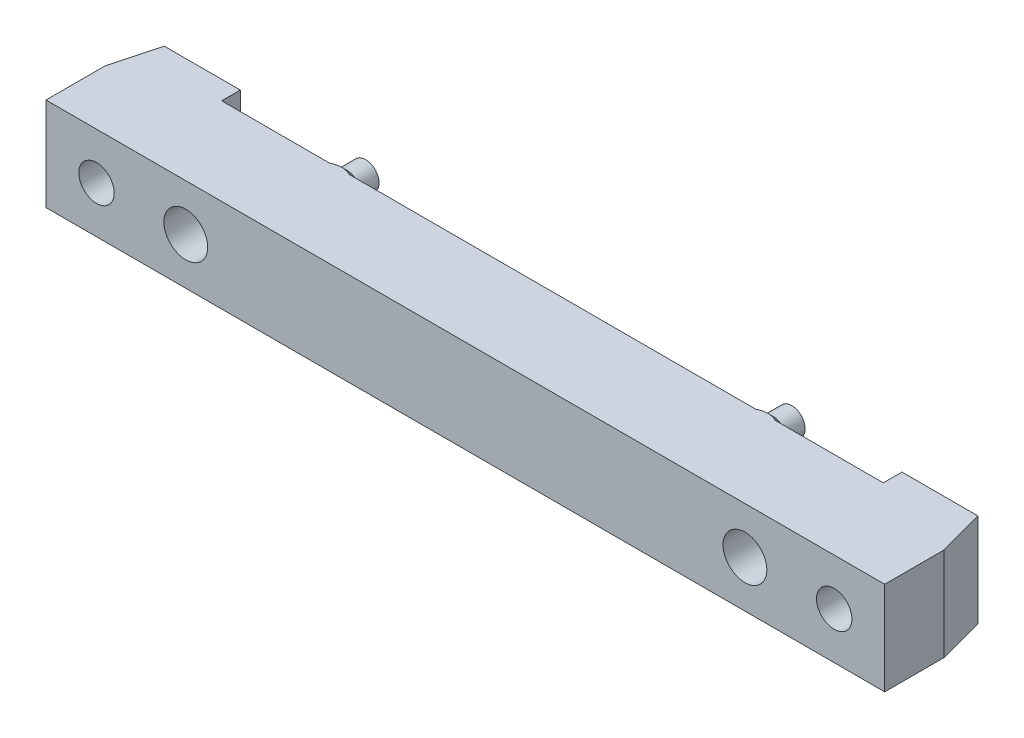
from build123d import *
from OCP.BRepFilletAPI import BRepFilletAPI_MakeChamfer

# Parameters (mm, degrees)
SKETCH2_W                       = 90
SKETCH2_H                       = 10
BOSS_EXTRUDE1_DEPTH             = 9.35
SKETCH4_W                       = 9.5
SKETCH4_H                       = 10
BOSS_EXTRUDE2_DEPTH             = 2
SKETCH5_R                       = 1.45
BOSS_EXTRUDE3_DEPTH             = 2.8
CHAMFER1_SIZE                   = 0.8
CHAMFER2_SIZE                   = 5
CHAMFER2_SIZE2                  = 1.339745962
F_13_0_185_DIAMETER_HOLE1_D     = 4.699
F_13_0_185_DIAMETER_HOLE1_DEPTH = 6.35
F_6_CLEARANCE_HOLE1_D           = 3.7973
F_6_CLEARANCE_HOLE1_ON_FACE_2_D = 3.7973
F_13_0_185_DIAMETER_HOLE2_D     = 4.699
F_13_0_185_DIAMETER_HOLE2_DEPTH = 6.35
F_6_CLEARANCE_HOLE2_D           = 3.7973


with BuildPart() as part:
    # Sketch2 → Boss-Extrude1 (new body)
    with BuildSketch(Plane.XY):
        with Locations((45, 5)):
            Rectangle(SKETCH2_W, SKETCH2_H)
    extrude(amount=BOSS_EXTRUDE1_DEPTH)

    # Sketch4 → Boss-Extrude2 (add)
    with BuildSketch(Plane(origin=(0, 0, 0), x_dir=(-1, 0, 0), z_dir=(0, 0, -1))):
        with Locations((-4.75, 5)):
            Rectangle(SKETCH4_W, SKETCH4_H)
        with Locations((-85.25, 5)):
            Rectangle(SKETCH4_W, SKETCH4_H)
    extrude(amount=BOSS_EXTRUDE2_DEPTH)

    # Sketch5 → Boss-Extrude3 (add)
    with BuildSketch(Plane(origin=(0, 0, 0), x_dir=(-1, 0, 0), z_dir=(0, 0, -1))):
        with Locations(Location((-67.863406388, 8.0148451, 0), (0, 0, 180))):
            Circle(SKETCH5_R)
        with Locations(Location((-22.143406388, 8.0148451, 0), (0, 0, 180))):
            Circle(SKETCH5_R)
    extrude(amount=BOSS_EXTRUDE3_DEPTH)

    # Chamfer1
    # the kernel refuses this chamfer: 0.8 mm, written as the material it adds along each edge
    with BuildSketch(Plane(origin=(67.863406388, 8.0148451, 0), x_dir=(1, 0, 0), z_dir=(0, 1, 0))) as chamfer1_piece_1_section:
        Polygon((1.45 + CHAMFER1_SIZE, 0), (1.45, CHAMFER1_SIZE), (1.45, 0), align=None)
    chamfer1_piece_1 = revolve(axis=Axis((67.863406388, 8.0148451, 0), (0, 0, -1)), mode=Mode.PRIVATE)
    chamfer1_piece_1 = split(chamfer1_piece_1, bisect_by=Plane(origin=(66.024382204, 10, -0.389024184), z_dir=(0, -1, 0)), keep=Keep.TOP, mode=Mode.PRIVATE)
    add(chamfer1_piece_1)
    with BuildSketch(Plane(origin=(22.143406388, 8.0148451, 0), x_dir=(1, 0, 0), z_dir=(0, 1, 0))) as chamfer1_piece_2_section:
        Polygon((1.45 + CHAMFER1_SIZE, 0), (1.45, CHAMFER1_SIZE), (1.45, 0), align=None)
    chamfer1_piece_2 = revolve(axis=Axis((22.143406388, 8.0148451, 0), (0, 0, -1)), mode=Mode.PRIVATE)
    chamfer1_piece_2 = split(chamfer1_piece_2, bisect_by=Plane(origin=(20.304382204, 10, -0.389024184), z_dir=(0, -1, 0)), keep=Keep.TOP, mode=Mode.PRIVATE)
    add(chamfer1_piece_2)

    # Chamfer2: one chamfer whose edges measure the first distance from different faces: ONE call of the kernel's chamfer builder (chamfer() names one face for all edges)
    chamfer2_edges_1 = [part.edges().sort_by_distance(p)[0] for p in [
        (0, 5, -2),
    ]]
    chamfer2_side_1 = [part.faces().sort_by_distance(p)[0] for p in [
        (0, 5, 3.675),
    ]]
    chamfer2_edges_2 = [part.edges().sort_by_distance(p)[0] for p in [
        (90, 5, -2),
    ]]
    chamfer2_side_2 = [part.faces().sort_by_distance(p)[0] for p in [
        (90, 5, 3.675),
    ]]
    chamfer2 = BRepFilletAPI_MakeChamfer(part.part.solid().wrapped)
    for e in chamfer2_edges_1:
        chamfer2.Add(CHAMFER2_SIZE, CHAMFER2_SIZE2, e.wrapped, chamfer2_side_1[0].wrapped)  # the first distance lies on this face
    for e in chamfer2_edges_2:
        chamfer2.Add(CHAMFER2_SIZE, CHAMFER2_SIZE2, e.wrapped, chamfer2_side_2[0].wrapped)  # the first distance lies on this face
    add(Compound.cast(chamfer2.Shape()), mode=Mode.REPLACE)

    # #13 (0.185) Diameter Hole1
    with Locations(Plane(origin=(84.580127019, 5, -2), x_dir=(-1, 0, 0), z_dir=(0, 0, -1))):
        with Locations((0, 0), (79.160254038, 0)):
            Hole(F_13_0_185_DIAMETER_HOLE1_D / 2, depth=F_13_0_185_DIAMETER_HOLE1_DEPTH)

    # #6 Clearance Hole1 (through all)
    with Locations(Plane(origin=(84.580127019, 5, 4.35), x_dir=(-1, 0, 0), z_dir=(0, 0, -1))):
        with Locations((0, 0), (79.160254038, 0)):
            Hole(F_6_CLEARANCE_HOLE1_D / 2)

    # #6 Clearance Hole1 on face 2 (through all)
    with Locations(Plane(origin=(5.419872981, 5, 0), x_dir=(-1, 0, 0), z_dir=(0, 0, -1))):
        with Locations((0, 0)):
            Hole(F_6_CLEARANCE_HOLE1_ON_FACE_2_D / 2)

    # #13 (0.185) Diameter Hole2
    with Locations(Plane(origin=(75, 5, 9.35), x_dir=(1, 0, 0), z_dir=(0, 0, 1))):
        with Locations((0, 0), (-60, 0)):
            Hole(F_13_0_185_DIAMETER_HOLE2_D / 2, depth=F_13_0_185_DIAMETER_HOLE2_DEPTH)

    # #6 Clearance Hole2 (through all)
    with Locations(Plane(origin=(75, 5, 3), x_dir=(1, 0, 0), z_dir=(0, 0, 1))):
        with Locations((0, 0), (-60, 0)):
            Hole(F_6_CLEARANCE_HOLE2_D / 2)


solid = part.part
